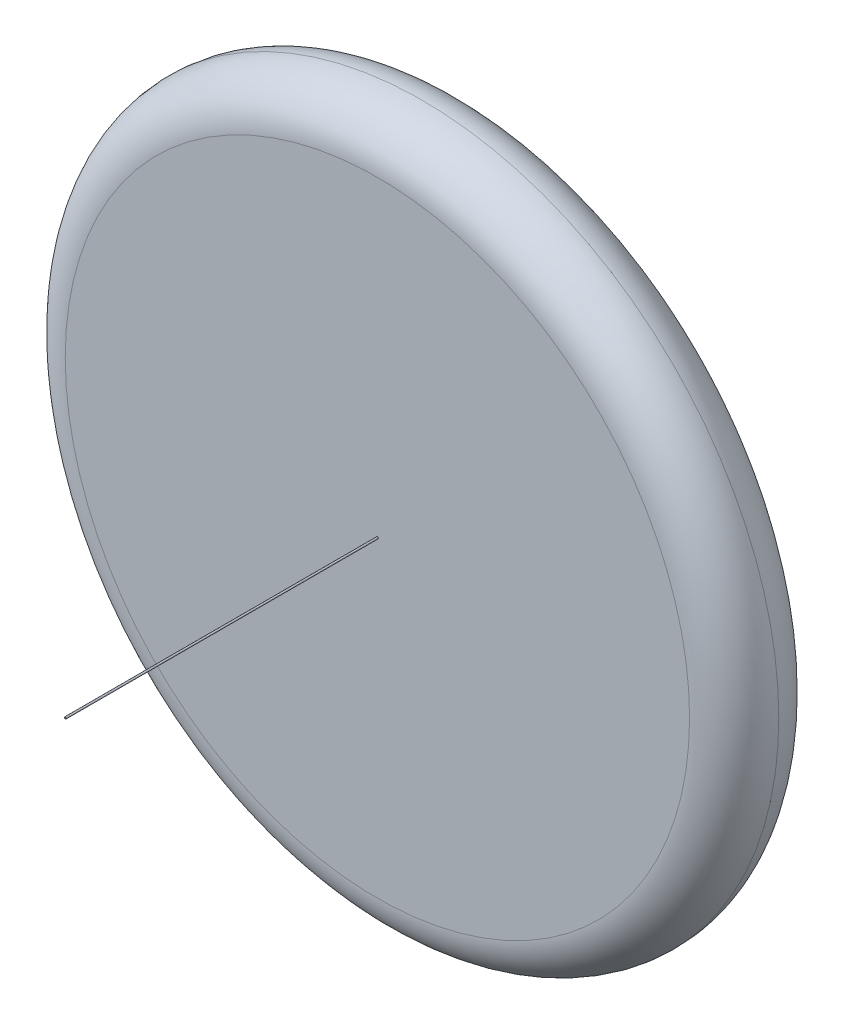
from build123d import *

# Parameters (mm, degrees)
SKETCH1_R           = 8
BOSS_EXTRUDE1_DEPTH = 2
FILLET1_R           = 1
SKETCH3_R           = 0.02
BOSS_EXTRUDE2_DEPTH = 7


with BuildPart() as part:
    # Sketch1 → Boss-Extrude1 (new body)
    with BuildSketch(Plane.XY):
        Circle(SKETCH1_R)
    extrude(amount=BOSS_EXTRUDE1_DEPTH)

    # Fillet1
    fillet1_edges = [part.edges().sort_by_distance(p)[0] for p in [
        (-8, 0, 0),
        (-8, 0, 2),
    ]]
    fillet(fillet1_edges, radius=FILLET1_R - 0.0001)  # a hair under: the kernel refuses the full size

    # Sketch3 → Boss-Extrude2 (add)
    with BuildSketch(Plane.XY.offset(2)):
        Circle(SKETCH3_R)
    extrude(amount=BOSS_EXTRUDE2_DEPTH)


solid = part.part
